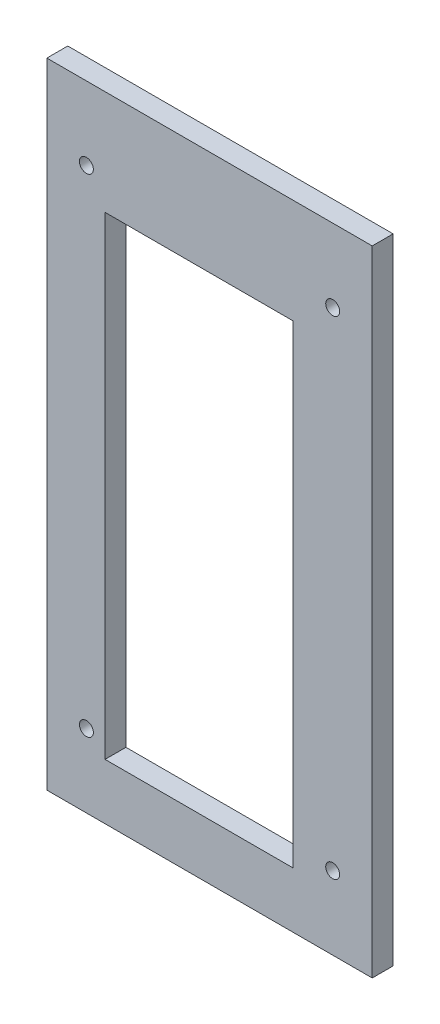
from build123d import *

# Parameters (mm, degrees)
SKETCH1_W           = 46.7
SKETCH1_H           = 91
SKETCH1_R           = 1
SKETCH1_W_2         = 27
SKETCH1_H_2         = 68
BOSS_EXTRUDE1_DEPTH = 3


with BuildPart() as part:
    # Sketch1 → Boss-Extrude1 (new body)
    with BuildSketch(Plane.XY):
        Rectangle(SKETCH1_W, SKETCH1_H)
        with Locations((17.675, 35)):
            Circle(SKETCH1_R, mode=Mode.SUBTRACT)
        with Locations((17.675, -35)):
            Circle(SKETCH1_R, mode=Mode.SUBTRACT)
        with Locations((-17.675, 35)):
            Circle(SKETCH1_R, mode=Mode.SUBTRACT)
        with Locations((-17.675, -35)):
            Circle(SKETCH1_R, mode=Mode.SUBTRACT)
        with Locations((-1.5, -3.5)):
            Rectangle(SKETCH1_W_2, SKETCH1_H_2, mode=Mode.SUBTRACT)
    extrude(amount=BOSS_EXTRUDE1_DEPTH)


solid = part.part
